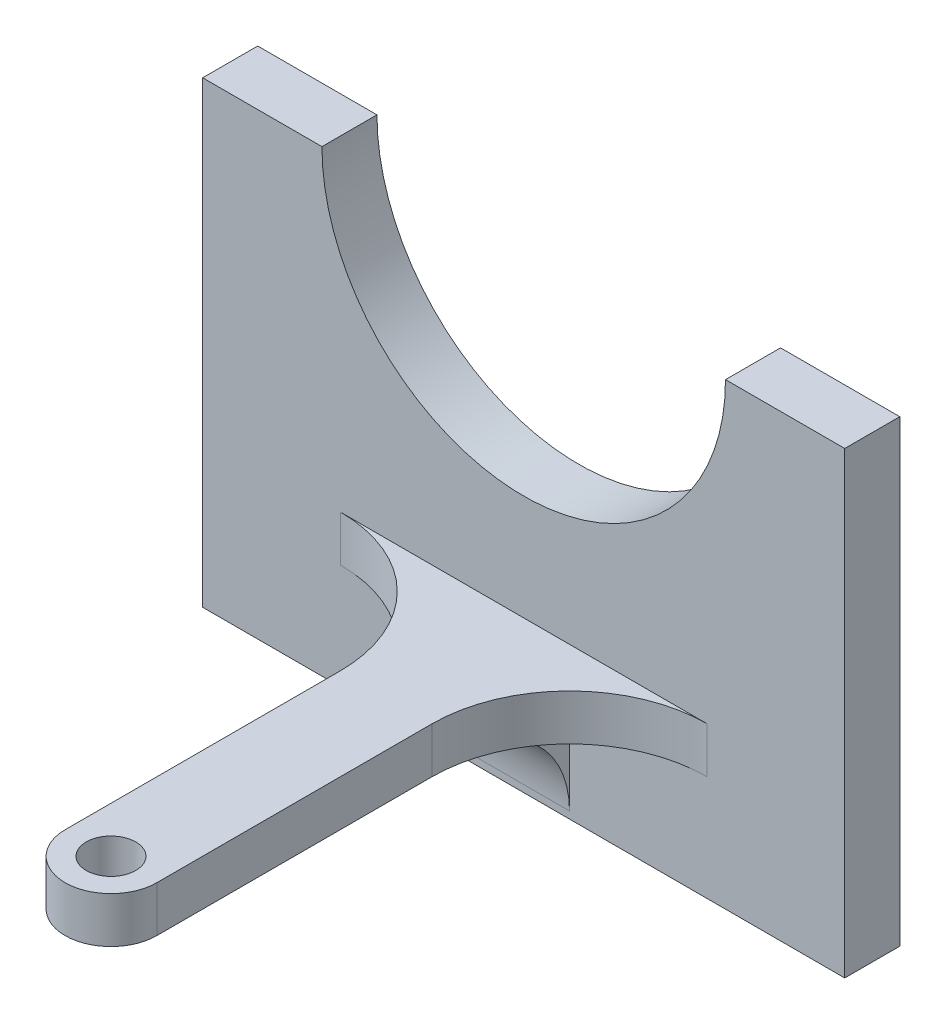
from build123d import *

# Parameters (mm, degrees)
BOSS_EXTRUDE1_DEPTH      = 4
BOSS_EXTRUDE1_DEPTH_BACK = 2
SKETCH2_W                = 10
SKETCH2_H                = 5
BOSS_EXTRUDE2_DEPTH      = 50
FILLET1_RADIUS           = 5
FILLET1_LENGTH           = 5
SKETCH3_R                = 2.7
CUT_EXTRUDE1_DEPTH       = 35
BOSS_EXTRUDE3_DEPTH      = 5
BOSS_EXTRUDE5_START      = -5
BOSS_EXTRUDE5_DEPTH      = 10


# Read off the part's stored shape, not the designer's step: Boss-Extrude5
with BuildPart() as part:
    # Sketch1 → Boss-Extrude1 (new, two sides: drawn at the far end of the back side and taken through both)
    with BuildSketch(Plane.XY.offset(-BOSS_EXTRUDE1_DEPTH_BACK)):
        with BuildLine():
            Line((-35, -25), (35, -25))
            Line((35, -25), (35, 25))
            Line((35, 25), (22, 25))
            ThreePointArc((22, 25), (0, 3), (-22, 25))
            Line((-22, 25), (-35, 25))
            Line((-35, 25), (-35, -25))
        make_face()
    extrude(amount=BOSS_EXTRUDE1_DEPTH + BOSS_EXTRUDE1_DEPTH_BACK)

    # Sketch2 → Boss-Extrude2 (add)
    with BuildSketch(Plane.XY.offset(4)):
        with Locations((0, -11)):
            Rectangle(SKETCH2_W, SKETCH2_H)
    extrude(amount=BOSS_EXTRUDE2_DEPTH)

    # Fillet1: full round fillet: the end face becomes a half cylinder, R = half its width
    fillet1_face = Plane((0, -11, 54), x_dir=(0, -1, 0), z_dir=(0, 0, 1))  # on the end face: x along it, z out of the body
    fillet1_slab = fillet1_face.offset(-FILLET1_RADIUS / 2) * Box(FILLET1_LENGTH, 2 * FILLET1_RADIUS, FILLET1_RADIUS, mode=Mode.PRIVATE)  # the body's end, R deep
    fillet1_round = Plane((0, -11, 49), x_dir=(0, 0, 1), z_dir=(0, -1, 0)) * Cylinder(FILLET1_RADIUS, FILLET1_LENGTH, mode=Mode.PRIVATE)  # its axis R under the face
    add(fillet1_slab - fillet1_round, mode=Mode.SUBTRACT)

    # Sketch3 → Cut-Extrude1 (cut)
    with BuildSketch(Plane(origin=(0, -8.5, 0), x_dir=(1, 0, 0), z_dir=(0, 1, 0))):
        with Locations(Location((0, -49, 0), (0, 0, 180))):
            Circle(SKETCH3_R)
    extrude(amount=-CUT_EXTRUDE1_DEPTH, mode=Mode.SUBTRACT)

    # Sketch6 → Boss-Extrude3 (add)
    with BuildSketch(Plane.XZ.offset(13.5)):
        with BuildLine():
            Line((5, 4), (20, 4))
            ThreePointArc((20, 4), (9.393398282, 8.393398282), (5, 19))
            Line((5, 19), (5, 4))
        make_face()
        with BuildLine():
            Line((-5, 4), (-20, 4))
            ThreePointArc((-20, 4), (-9.393398282, 8.393398282), (-5, 19))
            Line((-5, 19), (-5, 4))
        make_face()
    extrude(amount=-BOSS_EXTRUDE3_DEPTH)

    # Boss-Extrude5 outline → Boss-Extrude5 (add)
    with BuildSketch(Plane(origin=(0, 0, 0), x_dir=(0, 0, -1), z_dir=(1, 0, 0)).offset(BOSS_EXTRUDE5_START)):
        with BuildLine():
            ThreePointArc((-13.190244239, -13.5), (-6.643691612, -17.19601893), (-4, -24.233689133))
            Line((-4, -24.233689133), (-4, -13.5))
            Line((-4, -13.5), (-13.190244239, -13.5))
        make_face()
    extrude(amount=BOSS_EXTRUDE5_DEPTH)


solid = part.part
